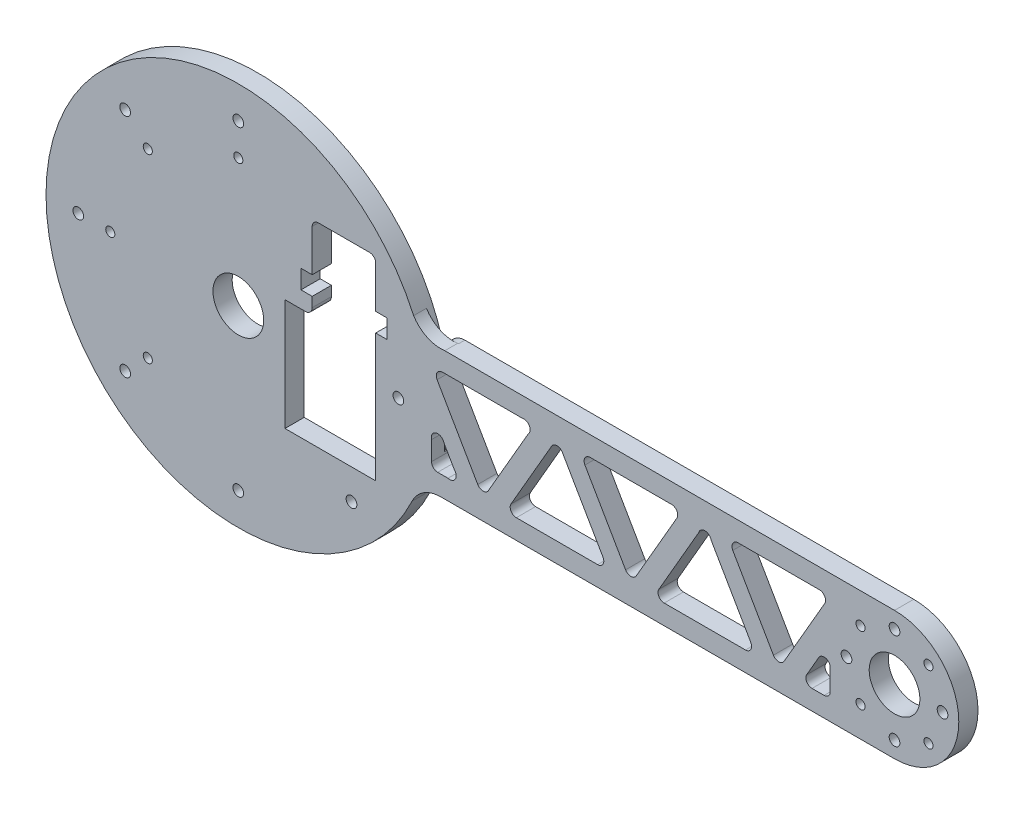
from build123d import *

# Parameters (mm, degrees)
SKETCH1_R              = 8
SKETCH1_R_2            = 1.75
SKETCH1_R_3            = 1.5
BOSS_EXTRUDE1_DEPTH    = 6
CUT_EXTRUDE2_DEPTH     = 233.939906414
FILLET3_R              = 10
FILLET4_R              = 2
SKETCH4_R              = 61.5
SKETCH4_R_2            = 60
CUT_EXTRUDE3_DEPTH     = 2
FILLET6_R              = 5
CUT_EXTRUDE5_DEPTH     = 233.939906414
FILLET7_R              = 2
MOVE_FACE1_OUTLINE_R   = 60.08
MOVE_FACE1_OUTLINE_R_2 = 60
MOVE_FACE1_OUTLINE_R_3 = 8
MOVE_FACE1_OUTLINE_R_4 = 7.92
MOVE_FACE1_OUTLINE_R_5 = 1.75
MOVE_FACE1_OUTLINE_R_6 = 1.67
MOVE_FACE1_OUTLINE_R_7 = 1.5
MOVE_FACE1_OUTLINE_R_8 = 1.42
MOVE_FACE1_DEPTH       = 6
MOVE_START             = 2
MOVE_FACE1_2_DEPTH     = 4
MOVE_FACE1_3_DEPTH     = 2


# Read off the part's stored shape, not the designer's step: Move Face1
with BuildPart() as part:
    # Sketch1 → Boss-Extrude1 (new body)
    with BuildSketch(Plane.XY):
        with BuildLine():
            Line((56.568542495, -20), (205, -20))
            ThreePointArc((205, -20), (225, 0), (205, 20))
            Line((205, 20), (56.568542495, 20))
            ThreePointArc((56.568542495, 20), (-60, 0), (56.568542495, -20))
        make_face()
        Circle(SKETCH1_R, mode=Mode.SUBTRACT)
        with Locations((205, 0)):
            Circle(SKETCH1_R, mode=Mode.SUBTRACT)
        with Locations((205, -15)):
            Circle(SKETCH1_R_2, mode=Mode.SUBTRACT)
        with Locations((215.606601718, -10.606601718)):
            Circle(SKETCH1_R_3, mode=Mode.SUBTRACT)
        with Locations((190, 0)):
            Circle(SKETCH1_R_2, mode=Mode.SUBTRACT)
        with Locations((194.393398282, -10.606601718)):
            Circle(SKETCH1_R_3, mode=Mode.SUBTRACT)
        with Locations((205, 15)):
            Circle(SKETCH1_R_2, mode=Mode.SUBTRACT)
        with Locations((194.393398282, 10.606601718)):
            Circle(SKETCH1_R_3, mode=Mode.SUBTRACT)
        with Locations((220, 0)):
            Circle(SKETCH1_R_2, mode=Mode.SUBTRACT)
        with Locations((215.606601718, 10.606601718)):
            Circle(SKETCH1_R_3, mode=Mode.SUBTRACT)
        with Locations((0, -50)):
            Circle(SKETCH1_R_2, mode=Mode.SUBTRACT)
        with Locations((-28.284271247, -28.284271247)):
            Circle(SKETCH1_R_3, mode=Mode.SUBTRACT)
        with Locations((-35.355339059, -35.355339059)):
            Circle(SKETCH1_R_2, mode=Mode.SUBTRACT)
        with Locations((-40, 0)):
            Circle(SKETCH1_R_3, mode=Mode.SUBTRACT)
        with Locations((-50, 0)):
            Circle(SKETCH1_R_2, mode=Mode.SUBTRACT)
        with Locations((-28.284271247, 28.284271247)):
            Circle(SKETCH1_R_3, mode=Mode.SUBTRACT)
        with Locations((-35.355339059, 35.355339059)):
            Circle(SKETCH1_R_2, mode=Mode.SUBTRACT)
        with Locations((0, 40)):
            Circle(SKETCH1_R_3, mode=Mode.SUBTRACT)
        with Locations((0, 50)):
            Circle(SKETCH1_R_2, mode=Mode.SUBTRACT)
        with Locations((50, 0)):
            Circle(SKETCH1_R_2, mode=Mode.SUBTRACT)
        with Locations((35.355339059, -35.355339059)):
            Circle(SKETCH1_R_2, mode=Mode.SUBTRACT)
    extrude(amount=BOSS_EXTRUDE1_DEPTH)

    # Sketch3 → Cut-Extrude2 (cut, through all)
    with BuildSketch(Plane.XY.offset(6)):
        Polygon((14.5, -26), (43, -26), (43, 14), (46.5, 14), (46.5, 20), (43, 20), (43, 35), (23, 35), (23, 20), (19.5, 20), (19.5, 14), (23, 14), (23, 9), (14.5, 9), align=None)
    extrude(amount=-CUT_EXTRUDE2_DEPTH, mode=Mode.SUBTRACT)

    # Fillet3
    fillet3_edges = [part.edges().sort_by_distance(p)[0] for p in [
        (56.568542495, 20, 3),
        (56.568542495, -20, 3),
    ]]
    fillet(fillet3_edges, radius=FILLET3_R)

    # Fillet4
    fillet4_edges = [part.edges().sort_by_distance(p)[0] for p in [
        (23, 9, 3),
        (23, 35, 3),
        (43, 35, 3),
    ]]
    fillet(fillet4_edges, radius=FILLET4_R)

    # Sketch4 → Cut-Extrude3 (cut)
    with BuildSketch(Plane(origin=(0, 0, 0), x_dir=(-1, 0, 0), z_dir=(0, 0, -1))):
        Circle(SKETCH4_R)
        Circle(SKETCH4_R_2, mode=Mode.SUBTRACT)
    extrude(amount=-CUT_EXTRUDE3_DEPTH, mode=Mode.SUBTRACT)

    # Fillet6
    # the kernel refuses this fillet: 5 mm, written as the material it takes off along each edge
    with BuildSketch(Plane(origin=(57.50107649, -21.81458692, -20.752870911), x_dir=(0.2907993374823747, 0.9567840641021421, 0), z_dir=(0, 0, 1))) as fillet6_piece_1:
        with BuildLine():
            CenterArc((8.63859342, -4.988600088), FILLET6_R, 93.869776954, 103.036040292)
            Line((3.854673099, -6.442596775), (3.376281067, -6.587996444))
            ThreePointArc((3.376281067, -6.587996444), (2.928265838, -5.113942771), (-0.308059139, -0.393826824))
            Line((-0.308059139, -0.393826824), (0.033744506, 0.498860009))
            ThreePointArc((0.033744506, 0.498860009), (4.150574182, 0.359781078), (8.267403859, 0.498860009))
            Line((8.267403859, 0.498860009), (8.301148365, 0))
        make_face()
    extrude(amount=22.752870911, mode=Mode.SUBTRACT)
    with BuildSketch(Plane(origin=(57.50107649, 21.81458692, -20.752870911), x_dir=(0.2907993374823739, -0.9567840641021422, 0), z_dir=(0, 0, 1))) as fillet6_piece_2:
        with BuildLine():
            CenterArc((8.63859342, 4.988600088), FILLET6_R, 163.094182754, 103.036040292)
            Line((3.854673099, 6.442596775), (3.376281067, 6.587996444))
            ThreePointArc((3.376281067, 6.587996444), (2.928265838, 5.113942771), (-0.308059139, 0.393826824))
            Line((-0.308059139, 0.393826824), (0.033744506, -0.498860009))
            ThreePointArc((0.033744506, -0.498860009), (4.150574182, -0.359781078), (8.267403859, -0.498860009))
            Line((8.267403859, -0.498860009), (8.301148365, 0))
        make_face()
    extrude(amount=22.752870911, mode=Mode.SUBTRACT)

    # Sketch6 → Cut-Extrude5 (cut, through all)
    with BuildSketch(Plane.XY.offset(6)):
        Polygon((60.292341855, 14), (92.62395693, 14), (76.458149392, -14), align=None)
        Polygon((83.386352623, -14), (99.55216016, 14), (115.717967697, -14), align=None)
        Polygon((106.48036339, 14), (122.646170928, -14), (138.811978465, 14), align=None)
        Polygon((129.574374158, -14), (145.740181695, 14), (161.905989232, -14), align=None)
        Polygon((152.668384925, 14), (168.834192463, -14), (185, 14), align=None)
        Polygon((60.292341855, 2), (60.292341855, -14), (69.529946162, -14), align=None)
        Polygon((185, 2), (185, -14), (175.762395693, -14), align=None)
    extrude(amount=-CUT_EXTRUDE5_DEPTH, mode=Mode.SUBTRACT)

    # Fillet7
    fillet7_edges = [part.edges().sort_by_distance(p)[0] for p in [
        (60.292341855, 14, 3),
        (185, 2, 3),
        (175.762395693, -14, 3),
        (185, -14, 3),
        (152.668384925, 14, 3),
        (168.834192463, -14, 3),
        (185, 14, 3),
        (129.574374158, -14, 3),
        (161.905989232, -14, 3),
        (145.740181695, 14, 3),
        (138.811978465, 14, 3),
        (122.646170928, -14, 3),
        (106.48036339, 14, 3),
        (115.717967697, -14, 3),
        (99.55216016, 14, 3),
        (83.386352623, -14, 3),
        (60.292341855, -14, 3),
        (76.458149392, -14, 3),
        (69.529946162, -14, 3),
        (92.62395693, 14, 3),
        (60.292341855, 2, 4),
    ]]
    fillet(fillet7_edges, radius=FILLET7_R)

    # Move Face1 outline → Move Face1 (add)
    # profile 1 of 31: a face of its own
    with BuildSketch(Plane.XY):
        with BuildLine():
            ThreePointArc((59.837106665, 13.854135338), (61.206368938, 5.118281102), (61.307020533, -3.723658599))
            ThreePointArc((61.307020533, -3.723658599), (61.348170817, -3.700996103), (61.389842031, -3.67930637))
            ThreePointArc((61.389842031, -3.67930637), (61.284031957, 5.149507464), (59.915044935, 13.872180451))
            ThreePointArc((59.915044935, 13.872180451), (60.872167271, 18.111342335), (64.786186799, 20))
            Line((64.786186799, 20), (205, 20))
            ThreePointArc((205, 20), (225, 0), (205, -20))
            Line((205, -20), (64.786186799, -20))
            ThreePointArc((64.786186799, -20), (60.872167271, -18.111342335), (59.915044935, -13.872180451))
            ThreePointArc((59.915044935, -13.872180451), (60.111708651, -12.993555444), (60.295488483, -12.112145497))
            ThreePointArc((60.295488483, -12.112145497), (60.918349678, -13.453322227), (62.292341855, -14))
            Line((62.292341855, -14), (66.065844547, -14))
            ThreePointArc((66.065844547, -14), (65.783001835, -13.979898987), (65.505844547, -13.92))
            Line((65.505844547, -13.92), (62.292341855, -13.92))
            ThreePointArc((62.292341855, -13.92), (60.934696835, -13.35764502), (60.372341855, -12))
            Line((60.372341855, -12), (60.372341855, -11.295872651))
            ThreePointArc((60.372341855, -11.295872651), (60.118333771, -12.577851352), (59.837106665, -13.854135338))
            ThreePointArc((59.837106665, -13.854135338), (60.809542958, -18.161123813), (64.786186799, -20.08))
            Line((64.786186799, -20.08), (205, -20.08))
            ThreePointArc((205, -20.08), (225.08, 0), (205, 20.08))
            Line((205, 20.08), (64.786186799, 20.08))
            ThreePointArc((64.786186799, 20.08), (64.569116303, 20.075360125), (64.352442334, 20.061448976))
            ThreePointArc((64.352442334, 20.061448976), (64.267267313, 20.052331918), (64.18201732, 20.043944809))
            ThreePointArc((64.18201732, 20.043944809), (60.628293024, 17.918616001), (59.837106665, 13.854135338))
        make_face()
    # profile 2 of 31: a face of its own
    with BuildSketch(Plane.XY):
        with BuildLine():
            Line((67.797895355, -11), (64.024392662, -4.464101615))
            ThreePointArc((64.024392662, -4.464101615), (64.148406031, -4.719101096), (64.23511063, -4.989075841))
            Line((64.23511063, -4.989075841), (67.448613322, -10.555025774))
            ThreePointArc((67.448613322, -10.555025774), (67.639066011, -10.765101532), (67.797895355, -11))
        make_face()
    # profile 3 of 31: a face of its own
    with BuildSketch(Plane.XY):
        Circle(MOVE_FACE1_OUTLINE_R)
        Circle(MOVE_FACE1_OUTLINE_R_2, mode=Mode.SUBTRACT)
    # profile 4 of 31: a face of its own
    with BuildSketch(Plane.XY):
        with BuildLine():
            Line((74.795380617, -10.96), (62.093674695, 11.04))
            ThreePointArc((62.093674695, 11.04), (62.093674695, 12.96), (63.75644347, 13.92))
            Line((63.75644347, 13.92), (88.599855315, 13.92))
            ThreePointArc((88.599855315, 13.92), (88.877012603, 13.979898987), (89.159855315, 14))
            Line((89.159855315, 14), (63.75644347, 14))
            ThreePointArc((63.75644347, 14), (62.024392663, 13), (62.024392663, 11))
            Line((62.024392663, 11), (74.726098585, -11))
            ThreePointArc((74.726098585, -11), (76.458149392, -12), (78.1902002, -11))
            Line((78.1902002, -11), (90.891906122, 11))
            ThreePointArc((90.891906122, 11), (90.733076778, 10.765101532), (90.54262409, 10.555025774))
            Line((90.54262409, 10.555025774), (78.120918168, -10.96))
            ThreePointArc((78.120918168, -10.96), (76.458149393, -11.92), (74.795380617, -10.96))
        make_face()
    # profile 5 of 31: a face of its own
    with BuildSketch(Plane.XY):
        with BuildLine():
            Line((158.441887617, -13.92), (133.038475773, -13.92))
            ThreePointArc((133.038475773, -13.92), (131.375706998, -12.96), (131.375706998, -11.04))
            Line((131.375706998, -11.04), (143.79741292, 10.475025774))
            ThreePointArc((143.79741292, 10.475025774), (143.884117519, 10.74500052), (144.008130888, 11))
            Line((144.008130888, 11), (131.306424965, -11))
            ThreePointArc((131.306424965, -11), (131.306424965, -13), (133.038475773, -14))
            Line((133.038475773, -14), (158.441887617, -14))
            ThreePointArc((158.441887617, -14), (160.173938425, -13), (160.173938425, -11))
            Line((160.173938425, -11), (147.472232503, 11))
            ThreePointArc((147.472232503, 11), (147.596245871, 10.745000519), (147.68295047, 10.475025774))
            Line((147.68295047, 10.475025774), (160.104656393, -11.04))
            ThreePointArc((160.104656393, -11.04), (160.104656393, -12.96), (158.441887617, -13.92))
        make_face()
    # profile 6 of 31: a face of its own
    with BuildSketch(Plane.XY):
        Circle(MOVE_FACE1_OUTLINE_R_3)
        Circle(MOVE_FACE1_OUTLINE_R_4, mode=Mode.SUBTRACT)
    # profile 7 of 31: a face of its own
    with BuildSketch(Plane.XY):
        with Locations((205, 0)):
            Circle(MOVE_FACE1_OUTLINE_R_3)
        with Locations((205, 0)):
            Circle(MOVE_FACE1_OUTLINE_R_4, mode=Mode.SUBTRACT)
    # profile 8 of 31: a face of its own
    with BuildSketch(Plane.XY):
        with Locations((205, -15)):
            Circle(MOVE_FACE1_OUTLINE_R_5)
        with Locations((205, -15)):
            Circle(MOVE_FACE1_OUTLINE_R_6, mode=Mode.SUBTRACT)
    # profile 9 of 31: a face of its own
    with BuildSketch(Plane.XY):
        with Locations((215.606601718, -10.606601718)):
            Circle(MOVE_FACE1_OUTLINE_R_7)
        with Locations((215.606601718, -10.606601718)):
            Circle(MOVE_FACE1_OUTLINE_R_8, mode=Mode.SUBTRACT)
    # profile 10 of 31: a face of its own
    with BuildSketch(Plane.XY):
        with Locations((190, 0)):
            Circle(MOVE_FACE1_OUTLINE_R_5)
        with Locations((190, 0)):
            Circle(MOVE_FACE1_OUTLINE_R_6, mode=Mode.SUBTRACT)
    # profile 11 of 31: a face of its own
    with BuildSketch(Plane.XY):
        with Locations((194.393398282, -10.606601718)):
            Circle(MOVE_FACE1_OUTLINE_R_7)
        with Locations((194.393398282, -10.606601718)):
            Circle(MOVE_FACE1_OUTLINE_R_8, mode=Mode.SUBTRACT)
    # profile 12 of 31: a face of its own
    with BuildSketch(Plane.XY):
        with Locations((205, 15)):
            Circle(MOVE_FACE1_OUTLINE_R_5)
        with Locations((205, 15)):
            Circle(MOVE_FACE1_OUTLINE_R_6, mode=Mode.SUBTRACT)
    # profile 13 of 31: a face of its own
    with BuildSketch(Plane.XY):
        with Locations((194.393398282, 10.606601718)):
            Circle(MOVE_FACE1_OUTLINE_R_7)
        with Locations((194.393398282, 10.606601718)):
            Circle(MOVE_FACE1_OUTLINE_R_8, mode=Mode.SUBTRACT)
    # profile 14 of 31: a face of its own
    with BuildSketch(Plane.XY):
        with Locations((220, 0)):
            Circle(MOVE_FACE1_OUTLINE_R_5)
        with Locations((220, 0)):
            Circle(MOVE_FACE1_OUTLINE_R_6, mode=Mode.SUBTRACT)
    # profile 15 of 31: a face of its own
    with BuildSketch(Plane.XY):
        with Locations((215.606601718, 10.606601718)):
            Circle(MOVE_FACE1_OUTLINE_R_7)
        with Locations((215.606601718, 10.606601718)):
            Circle(MOVE_FACE1_OUTLINE_R_8, mode=Mode.SUBTRACT)
    # profile 16 of 31: a face of its own
    with BuildSketch(Plane.XY):
        with Locations((0, -50)):
            Circle(MOVE_FACE1_OUTLINE_R_5)
        with Locations((0, -50)):
            Circle(MOVE_FACE1_OUTLINE_R_6, mode=Mode.SUBTRACT)
    # profile 17 of 31: a face of its own
    with BuildSketch(Plane.XY):
        with Locations((-28.284271247, -28.284271247)):
            Circle(MOVE_FACE1_OUTLINE_R_7)
        with Locations((-28.284271247, -28.284271247)):
            Circle(MOVE_FACE1_OUTLINE_R_8, mode=Mode.SUBTRACT)
    # profile 18 of 31: a face of its own
    with BuildSketch(Plane.XY):
        with Locations((-35.355339059, -35.355339059)):
            Circle(MOVE_FACE1_OUTLINE_R_5)
        with Locations((-35.355339059, -35.355339059)):
            Circle(MOVE_FACE1_OUTLINE_R_6, mode=Mode.SUBTRACT)
    # profile 19 of 31: a face of its own
    with BuildSketch(Plane.XY):
        with Locations((-40, 0)):
            Circle(MOVE_FACE1_OUTLINE_R_7)
        with Locations((-40, 0)):
            Circle(MOVE_FACE1_OUTLINE_R_8, mode=Mode.SUBTRACT)
    # profile 20 of 31: a face of its own
    with BuildSketch(Plane.XY):
        with Locations((-50, 0)):
            Circle(MOVE_FACE1_OUTLINE_R_5)
        with Locations((-50, 0)):
            Circle(MOVE_FACE1_OUTLINE_R_6, mode=Mode.SUBTRACT)
    # profile 21 of 31: a face of its own
    with BuildSketch(Plane.XY):
        with Locations((-28.284271247, 28.284271247)):
            Circle(MOVE_FACE1_OUTLINE_R_7)
        with Locations((-28.284271247, 28.284271247)):
            Circle(MOVE_FACE1_OUTLINE_R_8, mode=Mode.SUBTRACT)
    # profile 22 of 31: a face of its own
    with BuildSketch(Plane.XY):
        with Locations((-35.355339059, 35.355339059)):
            Circle(MOVE_FACE1_OUTLINE_R_5)
        with Locations((-35.355339059, 35.355339059)):
            Circle(MOVE_FACE1_OUTLINE_R_6, mode=Mode.SUBTRACT)
    # profile 23 of 31: a face of its own
    with BuildSketch(Plane.XY):
        with Locations((0, 40)):
            Circle(MOVE_FACE1_OUTLINE_R_7)
        with Locations((0, 40)):
            Circle(MOVE_FACE1_OUTLINE_R_8, mode=Mode.SUBTRACT)
    # profile 24 of 31: a face of its own
    with BuildSketch(Plane.XY):
        with Locations((0, 50)):
            Circle(MOVE_FACE1_OUTLINE_R_5)
        with Locations((0, 50)):
            Circle(MOVE_FACE1_OUTLINE_R_6, mode=Mode.SUBTRACT)
    # profile 25 of 31: a face of its own
    with BuildSketch(Plane.XY):
        with Locations((50, 0)):
            Circle(MOVE_FACE1_OUTLINE_R_5)
        with Locations((50, 0)):
            Circle(MOVE_FACE1_OUTLINE_R_6, mode=Mode.SUBTRACT)
    # profile 26 of 31: a face of its own
    with BuildSketch(Plane.XY):
        with Locations((35.355339059, -35.355339059)):
            Circle(MOVE_FACE1_OUTLINE_R_5)
        with Locations((35.355339059, -35.355339059)):
            Circle(MOVE_FACE1_OUTLINE_R_6, mode=Mode.SUBTRACT)
    # profile 27 of 31: a face of its own
    with BuildSketch(Plane.XY):
        with BuildLine():
            Line((21, 9), (14.5, 9))
            Line((14.5, 9), (14.5, -26))
            Line((14.5, -26), (43, -26))
            Line((43, -26), (43, 14))
            Line((43, 14), (46.5, 14))
            Line((46.5, 14), (46.5, 20))
            Line((46.5, 20), (43, 20))
            Line((43, 20), (43, 33))
            ThreePointArc((43, 33), (42.414213562, 34.414213562), (41, 35))
            Line((41, 35), (25, 35))
            ThreePointArc((25, 35), (23.585786438, 34.414213562), (23, 33))
            Line((23, 33), (23, 20))
            Line((23, 20), (19.5, 20))
            Line((19.5, 20), (19.5, 14))
            Line((19.5, 14), (23, 14))
            Line((23, 14), (23, 11))
            ThreePointArc((23, 11), (22.414213562, 9.585786438), (21, 9))
        make_face()
        with BuildLine():
            Line((14.58, -25.92), (14.58, 8.92))
            Line((14.58, 8.92), (21, 8.92))
            ThreePointArc((21, 8.92), (22.470782105, 9.529217895), (23.08, 11))
            Line((23.08, 11), (23.08, 14.08))
            Line((23.08, 14.08), (19.58, 14.08))
            Line((19.58, 14.08), (19.58, 19.92))
            Line((19.58, 19.92), (23.08, 19.92))
            Line((23.08, 19.92), (23.08, 33))
            ThreePointArc((23.08, 33), (23.64235498, 34.35764502), (25, 34.92))
            Line((25, 34.92), (41, 34.92))
            ThreePointArc((41, 34.92), (42.35764502, 34.35764502), (42.92, 33))
            Line((42.92, 33), (42.92, 19.92))
            Line((42.92, 19.92), (46.42, 19.92))
            Line((46.42, 19.92), (46.42, 14.08))
            Line((46.42, 14.08), (42.92, 14.08))
            Line((42.92, 14.08), (42.92, -25.92))
            Line((42.92, -25.92), (14.58, -25.92))
        make_face(mode=Mode.SUBTRACT)
    # profile 28 of 31: a face of its own
    with BuildSketch(Plane.XY):
        with BuildLine():
            ThreePointArc((137.079927657, 11), (137.079927657, 13), (135.34787685, 14))
            Line((135.34787685, 14), (109.944465005, 14))
            ThreePointArc((109.944465005, 14), (108.212414198, 13), (108.212414198, 11))
            Line((108.212414198, 11), (120.91412012, -11))
            ThreePointArc((120.91412012, -11), (122.646170928, -12), (124.378221735, -11))
            Line((124.378221735, -11), (137.079927657, 11))
        make_face()
        with BuildLine():
            Line((109.944465005, 13.92), (135.34787685, 13.92))
            ThreePointArc((135.34787685, 13.92), (137.010645625, 12.96), (137.010645625, 11.04))
            Line((137.010645625, 11.04), (124.308939703, -10.96))
            ThreePointArc((124.308939703, -10.96), (122.646170927, -11.92), (120.983402152, -10.96))
            Line((120.983402152, -10.96), (108.28169623, 11.04))
            ThreePointArc((108.28169623, 11.04), (108.28169623, 12.96), (109.944465005, 13.92))
        make_face(mode=Mode.SUBTRACT)
    # profile 29 of 31: a face of its own
    with BuildSketch(Plane.XY):
        with BuildLine():
            ThreePointArc((183.267949192, 11), (183.267949192, 13), (181.535898385, 14))
            Line((181.535898385, 14), (156.132486541, 14))
            ThreePointArc((156.132486541, 14), (154.400435733, 13), (154.400435733, 11))
            Line((154.400435733, 11), (167.102141655, -11))
            ThreePointArc((167.102141655, -11), (168.834192462, -12), (170.56624327, -11))
            Line((170.56624327, -11), (183.267949192, 11))
        make_face()
        with BuildLine():
            Line((156.132486541, 13.92), (181.535898385, 13.92))
            ThreePointArc((181.535898385, 13.92), (183.19866716, 12.96), (183.19866716, 11.04))
            Line((183.19866716, 11.04), (170.496961238, -10.96))
            ThreePointArc((170.496961238, -10.96), (168.834192462, -11.92), (167.171423687, -10.96))
            Line((167.171423687, -10.96), (154.469717765, 11.04))
            ThreePointArc((154.469717765, 11.04), (154.469717765, 12.96), (156.132486541, 13.92))
        make_face(mode=Mode.SUBTRACT)
    # profile 30 of 31: a face of its own
    with BuildSketch(Plane.XY):
        with BuildLine():
            ThreePointArc((85.11840343, -11), (85.11840343, -13), (86.850454238, -14))
            Line((86.850454238, -14), (112.253866082, -14))
            ThreePointArc((112.253866082, -14), (113.98591689, -13), (113.98591689, -11))
            Line((113.98591689, -11), (101.284210968, 11))
            ThreePointArc((101.284210968, 11), (99.55216016, 12), (97.820109352, 11))
            Line((97.820109352, 11), (85.11840343, -11))
        make_face()
        with BuildLine():
            Line((112.253866082, -13.92), (86.850454238, -13.92))
            ThreePointArc((86.850454238, -13.92), (85.187685462, -12.96), (85.187685462, -11.04))
            Line((85.187685462, -11.04), (97.889391385, 10.96))
            ThreePointArc((97.889391385, 10.96), (99.55216016, 11.92), (101.214928935, 10.96))
            Line((101.214928935, 10.96), (113.916634857, -11.04))
            ThreePointArc((113.916634857, -11.04), (113.916634857, -12.96), (112.253866082, -13.92))
        make_face(mode=Mode.SUBTRACT)
    # profile 31 of 31: a face of its own
    with BuildSketch(Plane.XY):
        with BuildLine():
            ThreePointArc((177.494446501, -11), (177.494446501, -13), (179.226497308, -14))
            Line((179.226497308, -14), (183, -14))
            ThreePointArc((183, -14), (184.414213562, -13.414213562), (185, -12))
            Line((185, -12), (185, -5.464101615))
            ThreePointArc((185, -5.464101615), (183.51763809, -3.532249963), (181.267949192, -4.464101615))
            Line((181.267949192, -4.464101615), (177.494446501, -11))
        make_face()
        with BuildLine():
            Line((183, -13.92), (179.226497308, -13.92))
            ThreePointArc((179.226497308, -13.92), (177.563728533, -12.96), (177.563728533, -11.04))
            Line((177.563728533, -11.04), (181.337231225, -4.504101615))
            ThreePointArc((181.337231225, -4.504101615), (183.496932567, -3.609524029), (184.92, -5.464101615))
            Line((184.92, -5.464101615), (184.92, -12))
            ThreePointArc((184.92, -12), (184.35764502, -13.35764502), (183, -13.92))
        make_face(mode=Mode.SUBTRACT)
    extrude(amount=MOVE_FACE1_DEPTH)

    # Move Face1 2 outline → Move Face1 2 (add)
    with BuildSketch(Plane.XY.offset(MOVE_START)):
        with BuildLine():
            Line((63.245553203, 20), (63.888189026, 20))
            ThreePointArc((63.888189026, 20), (64.034781848, 20.024120878), (64.18201732, 20.043944809))
            ThreePointArc((64.18201732, 20.043944809), (63.71430052, 20.010992244), (63.245553203, 20))
        make_face()
        with BuildLine():
            ThreePointArc((60.372341855, -6.024101615), (60.312442868, -5.746944327), (60.292341855, -5.464101615))
            Line((60.292341855, -5.464101615), (60.292341855, -11.715370829))
            ThreePointArc((60.292341855, -11.715370829), (60.332706457, -11.505691271), (60.372341855, -11.295872651))
            Line((60.372341855, -11.295872651), (60.372341855, -6.024101615))
        make_face()
        with BuildLine():
            ThreePointArc((64.50793191, 20.08), (64.430223434, 20.070420128), (64.352442334, 20.061448976))
            ThreePointArc((64.352442334, 20.061448976), (64.569116303, 20.075360125), (64.786186799, 20.08))
            Line((64.786186799, 20.08), (64.50793191, 20.08))
        make_face()
        with BuildLine():
            ThreePointArc((54.773667055, -24.687077537), (54.530793866, -25.21901902), (54.282754806, -25.748571429))
            ThreePointArc((54.282754806, -25.748571429), (57.943090164, -21.616069793), (63.245553203, -20.08))
            Line((63.245553203, -20.08), (64.786186799, -20.08))
            ThreePointArc((64.786186799, -20.08), (64.335409692, -20.059960474), (63.888189026, -20))
            Line((63.888189026, -20), (63.245553203, -20))
            ThreePointArc((63.245553203, -20), (58.404542184, -21.249879297), (54.773667055, -24.687077537))
        make_face()
    extrude(amount=MOVE_FACE1_2_DEPTH)

    # Move Face1 3 outline → Move Face1 3 (add)
    with BuildSketch(Plane.XY):
        with BuildLine():
            ThreePointArc((64.352442334, 20.061448976), (64.267156031, 20.053415386), (64.18201732, 20.043944809))
            ThreePointArc((64.18201732, 20.043944809), (64.267267313, 20.052331918), (64.352442334, 20.061448976))
        make_face()
    extrude(amount=MOVE_FACE1_3_DEPTH)


solid = part.part
